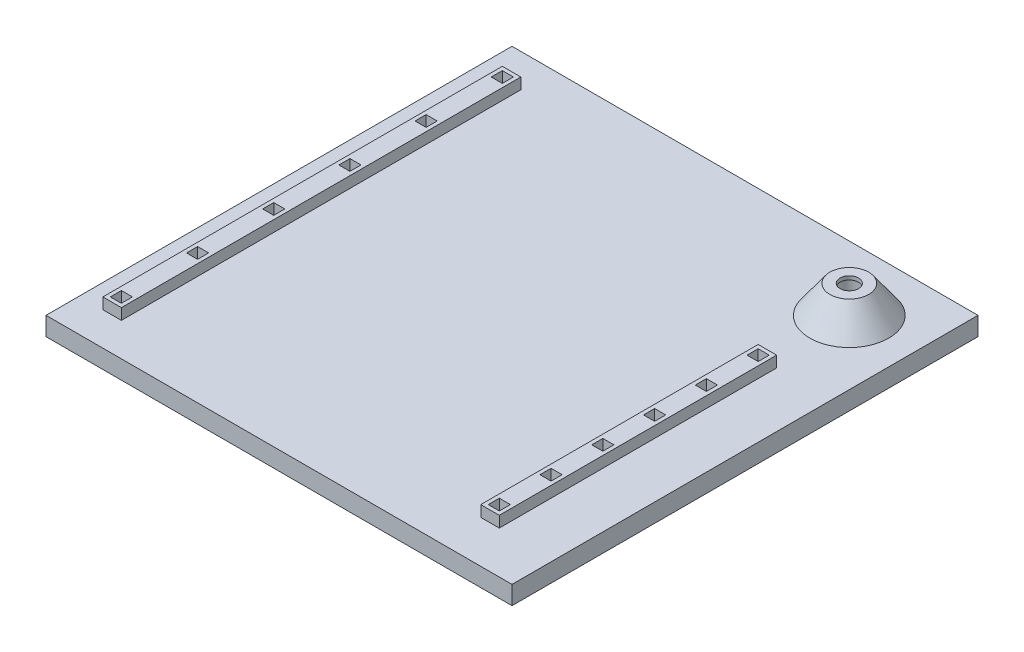
from build123d import *

# Parameters (mm, degrees)
SKETCH1_W           = 126
SKETCH1_H           = 126
BOSS_EXTRUDE1_DEPTH = 5
SKETCH3_R           = 12.5
BOSS_EXTRUDE2_DEPTH = 7.5
SKETCH4_R           = 2.95
CUT_EXTRUDE1_DEPTH  = 11.5
SKETCH6_R           = 2.5
CUT_EXTRUDE2_DEPTH  = 179.628805068
CHAMFER1_SIZE       = 10
CHAMFER1_SIZE_2     = 7.26542528
SKETCH9_W           = 5
SKETCH9_H           = 75
BOSS_EXTRUDE4_DEPTH = 3
SKETCH10_W          = 3
SKETCH10_H          = 3
CUT_EXTRUDE4_DEPTH  = 179.370401132
SKETCH11_W          = 5
SKETCH11_H          = 108
BOSS_EXTRUDE5_DEPTH = 3
SKETCH12_W          = 3
SKETCH12_H          = 3
CUT_EXTRUDE5_DEPTH  = 179.370401132


with BuildPart() as part:
    # Sketch1 → Boss-Extrude1 (new body)
    with BuildSketch(Plane(origin=(0, 0, 0), x_dir=(1, 0, 0), z_dir=(0, 1, 0))):
        with Locations((63, 63)):
            Rectangle(SKETCH1_W, SKETCH1_H)
    extrude(amount=BOSS_EXTRUDE1_DEPTH)

    # Sketch3 → Boss-Extrude2 (add)
    with BuildSketch(Plane(origin=(0, 5, 0), x_dir=(1, 0, 0), z_dir=(0, 1, 0))):
        with Locations(Location((108.6, 108.6, 0), (0, 0, 90))):
            Circle(SKETCH3_R)
    extrude(amount=BOSS_EXTRUDE2_DEPTH)

    # Sketch4 → Cut-Extrude1 (cut)
    with BuildSketch(Plane.XZ):
        with Locations(Location((108.6, -108.6, 0), (0, 0, 270))):
            Circle(SKETCH4_R)
    extrude(amount=-CUT_EXTRUDE1_DEPTH, mode=Mode.SUBTRACT)

    # Sketch6 → Cut-Extrude2 (cut, through all)
    with BuildSketch(Plane(origin=(0, 12.5, 0), x_dir=(1, 0, 0), z_dir=(0, 1, 0))):
        with Locations(Location((108.6, 108.6, 0), (0, 0, 270))):
            Circle(SKETCH6_R)
    extrude(amount=-CUT_EXTRUDE2_DEPTH, mode=Mode.SUBTRACT)

    # Chamfer1
    # the kernel refuses this chamfer: 10, 7.26542528 mm, written as the material it takes off along each edge
    with BuildSketch(Plane(origin=(108.6, 12.5, -108.6), x_dir=(0, 0, -1), z_dir=(1, 0, 0))) as chamfer1_piece_1_section:
        Polygon((12.5, -CHAMFER1_SIZE), (12.5 - CHAMFER1_SIZE_2, 0), (12.5, 0), align=None)
    chamfer1_piece_1 = revolve(axis=Axis((108.6, 12.5, -108.6), (0, 1, 0)), mode=Mode.PRIVATE)
    chamfer1_piece_1 = split(chamfer1_piece_1, bisect_by=Plane(origin=(108.6, 5, -100.650989912), z_dir=(0, 1, 0)), keep=Keep.TOP, mode=Mode.PRIVATE)
    add(chamfer1_piece_1, mode=Mode.SUBTRACT)

    # Sketch9 → Boss-Extrude4 (add)
    with BuildSketch(Plane(origin=(0, 5, 0), x_dir=(1, 0, 0), z_dir=(0, 1, 0))):
        with Locations((108.6, 48.95817816)):
            Rectangle(SKETCH9_W, SKETCH9_H)
    extrude(amount=BOSS_EXTRUDE4_DEPTH)

    # Sketch10 → Cut-Extrude4 (cut, through all)
    with BuildSketch(Plane(origin=(0, 8, 0), x_dir=(1, 0, 0), z_dir=(0, 1, 0))):
        with Locations((108.6, 83.95817816)):
            Rectangle(SKETCH10_W, SKETCH10_H)
        with Locations((108.6, 69.958932274)):
            Rectangle(SKETCH10_W, SKETCH10_H)
        with Locations((108.6, 55.959686388)):
            Rectangle(SKETCH10_W, SKETCH10_H)
        with Locations((108.6, 41.960440502)):
            Rectangle(SKETCH10_W, SKETCH10_H)
        with Locations((108.6, 27.961194616)):
            Rectangle(SKETCH10_W, SKETCH10_H)
        with Locations((108.6, 13.96194873)):
            Rectangle(SKETCH10_W, SKETCH10_H)
    extrude(amount=-CUT_EXTRUDE4_DEPTH, mode=Mode.SUBTRACT)

    # Sketch11 → Boss-Extrude5 (add)
    with BuildSketch(Plane(origin=(0, 5, 0), x_dir=(1, 0, 0), z_dir=(0, 1, 0))):
        with Locations((8.881061813, 63)):
            Rectangle(SKETCH11_W, SKETCH11_H)
    extrude(amount=BOSS_EXTRUDE5_DEPTH)

    # Sketch12 → Cut-Extrude5 (cut, through all)
    with BuildSketch(Plane(origin=(0, 8, 0), x_dir=(1, 0, 0), z_dir=(0, 1, 0))):
        with Locations((8.881061813, 114.5)):
            Rectangle(SKETCH12_W, SKETCH12_H)
        with Locations((8.881061813, 93.900163021)):
            Rectangle(SKETCH12_W, SKETCH12_H)
        with Locations((8.881061813, 73.300326041)):
            Rectangle(SKETCH12_W, SKETCH12_H)
        with Locations((8.881061813, 52.700489062)):
            Rectangle(SKETCH12_W, SKETCH12_H)
        with Locations((8.881061813, 32.100652082)):
            Rectangle(SKETCH12_W, SKETCH12_H)
        with Locations((8.881061813, 11.500815103)):
            Rectangle(SKETCH12_W, SKETCH12_H)
    extrude(amount=-CUT_EXTRUDE5_DEPTH, mode=Mode.SUBTRACT)


solid = part.part
